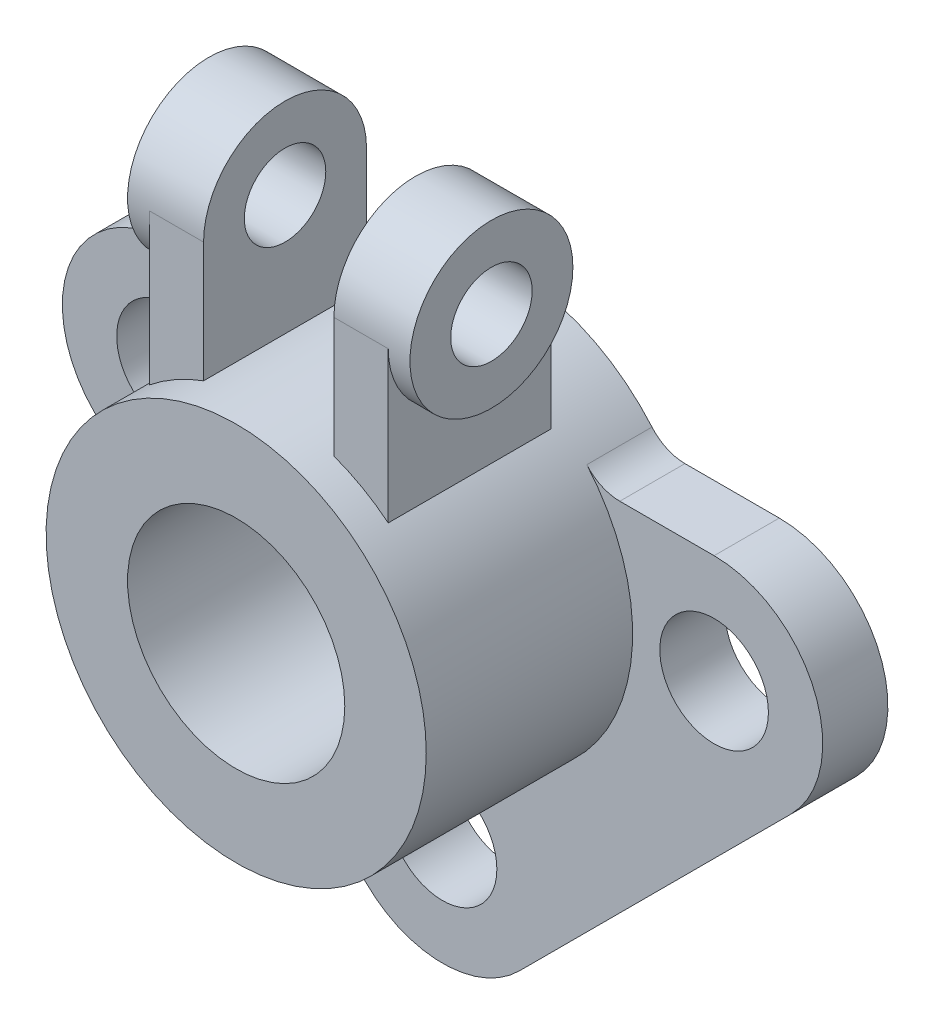
from build123d import *

# Parameters (mm, degrees)
SKETCH1_R                = 10
BOSS_EXTRUDE1_DEPTH      = 12
SKETCH1_3_R              = 35
SKETCH1_3_R_2            = 20
BOSS_EXTRUDE2_DEPTH      = 50
BOSS_EXTRUDE3_START      = 12
BOSS_EXTRUDE3_DEPTH      = 10
BOSS_EXTRUDE4_DEPTH      = 4
BOSS_EXTRUDE4_DEPTH_BACK = 10
SKETCH5_R                = 15
SKETCH6_R                = 7.5
CUT_EXTRUDE1_DEPTH       = 129.903064355
FILLET1_R                = 8


with BuildPart() as part:
    # Sketch1 → Boss-Extrude1 (new body)
    with BuildSketch(Plane.XY):
        with BuildLine():
            Line((50, 20), (28.722813233, 20))
            ThreePointArc((28.722813233, 20), (33.393850206, 10.480971731), (35, 0))
            ThreePointArc((35, 0), (-10.480971731, -33.393850206), (-28.722813233, 20))
            Line((-28.722813233, 20), (-50, 20))
            ThreePointArc((-50, 20), (-68.47759065, 7.653668647), (-64.142135624, -14.142135624))
            Line((-64.142135624, -14.142135624), (-14.142135624, -64.142135624))
            ThreePointArc((-14.142135624, -64.142135624), (0, -70), (14.142135624, -64.142135624))
            Line((14.142135624, -64.142135624), (64.142135624, -14.142135624))
            ThreePointArc((64.142135624, -14.142135624), (68.47759065, 7.653668647), (50, 20))
        make_face()
        with Locations((0, -50)):
            Circle(SKETCH1_R, mode=Mode.SUBTRACT)
        with Locations((-50, 0)):
            Circle(SKETCH1_R, mode=Mode.SUBTRACT)
        with Locations((50, 0)):
            Circle(SKETCH1_R, mode=Mode.SUBTRACT)
    extrude(amount=BOSS_EXTRUDE1_DEPTH)

    # Sketch1<3> → Boss-Extrude2 (add)
    with BuildSketch(Plane.XY):
        with Locations(Location((0, 0, 0), (0, 0, 145.150095421))):
            Circle(SKETCH1_3_R)
        Circle(SKETCH1_3_R_2, mode=Mode.SUBTRACT)
    extrude(amount=BOSS_EXTRUDE2_DEPTH)

    # Sketch4 → Boss-Extrude3 (add)
    with BuildSketch(Plane(origin=(0, 0, 0), x_dir=(0, 0, -1), z_dir=(1, 0, 0)).offset(BOSS_EXTRUDE3_START)):
        Polygon((-14, 55), (-44, 55), (-44, 35), (-44, 20), (-14, 20), align=None)
    extrude(amount=BOSS_EXTRUDE3_DEPTH)

    # Sketch5 → Boss-Extrude4 (add, two sides: drawn at the far end of the back side and taken through both)
    with BuildSketch(Plane(origin=(22, 0, 0), x_dir=(0, 0, -1), z_dir=(1, 0, 0)).offset(-BOSS_EXTRUDE4_DEPTH_BACK)):
        with Locations((-29, 55)):
            Circle(SKETCH5_R)
    extrude(amount=BOSS_EXTRUDE4_DEPTH + BOSS_EXTRUDE4_DEPTH_BACK)

    # Sketch6 → Cut-Extrude1 (cut, through all)
    with BuildSketch(Plane(origin=(26, 0, 0), x_dir=(0, 0, -1), z_dir=(1, 0, 0))):
        with Locations((-29, 55)):
            Circle(SKETCH6_R)
    extrude(amount=-CUT_EXTRUDE1_DEPTH, mode=Mode.SUBTRACT)

    # Mirror1: part across plane


with BuildPart() as part_1:
    add(part.part)
    add(part.part.mirror(Plane(origin=(0, 0, 0), x_dir=(0, 0, 1), z_dir=(1, 0, 0))))

    # Fillet1
    # the kernel refuses this fillet: 8 mm, written as the material it adds along each edge
    with BuildSketch(Plane(origin=(-28.722813233, 20, 0), x_dir=(-1, 0, 0), z_dir=(0, 0, 1))) as fillet1_piece_1:
        with BuildLine():
            CenterArc((3.911524511, -8), FILLET1_R, 90, 49.370671217)
            ThreePointArc((-2.159980185, -2.790697674), (-1.044795429, -1.422589257), (0, 0))
            Line((0, 0), (3.911524511, 0))
        make_face()
    extrude(amount=12)
    with BuildSketch(Plane(origin=(28.722813233, 20, 0), x_dir=(-0.6120739787659375, 0.7908005086731007, 0), z_dir=(0, 0, 1))) as fillet1_piece_2:
        with BuildLine():
            CenterArc((3.932261699, -7.989827403), FILLET1_R, 92.889712102, 49.370671217)
            Line((-2.394142371, -3.093235573), (0, 0))
            ThreePointArc((0, 0), (1.764476403, -0.04450511), (3.528952806, 0))
        make_face()
    extrude(amount=12)


solid = part_1.part
